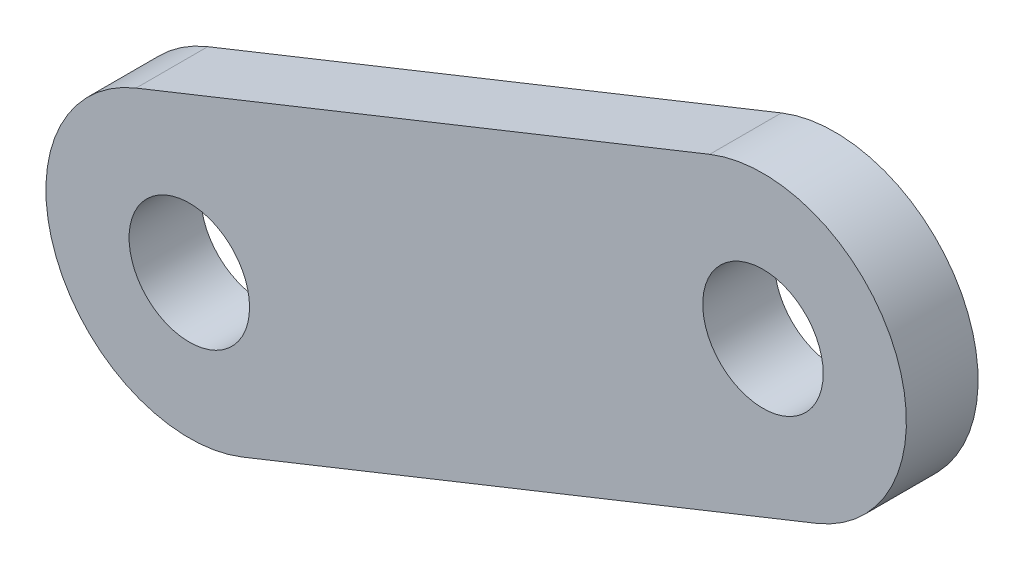
from build123d import *

# Parameters (mm, degrees)
SK_BIELA_INTERIOR_R  = 2.1
BIELA_INTERIOR_DEPTH = 2.5


with BuildPart() as part:
    # Sk_Biela_interior → Biela_interior (new body)
    with BuildSketch(Plane.XY.offset(51.9)):
        with BuildLine():
            Line((-42.143046618, -54.642383454), (-22.143046618, -46.642383454))
            ThreePointArc((-22.143046618, -46.642383454), (-19.357616546, -40.143046618), (-25.856953382, -37.357616546))
            Line((-25.856953382, -37.357616546), (-45.856953382, -45.357616546))
            ThreePointArc((-45.856953382, -45.357616546), (-48.642383454, -51.856953382), (-42.143046618, -54.642383454))
        make_face()
        with Locations((-24, -42)):
            Circle(SK_BIELA_INTERIOR_R, mode=Mode.SUBTRACT)
        with Locations((-44, -50)):
            Circle(SK_BIELA_INTERIOR_R, mode=Mode.SUBTRACT)
    extrude(amount=BIELA_INTERIOR_DEPTH)


solid = part.part
